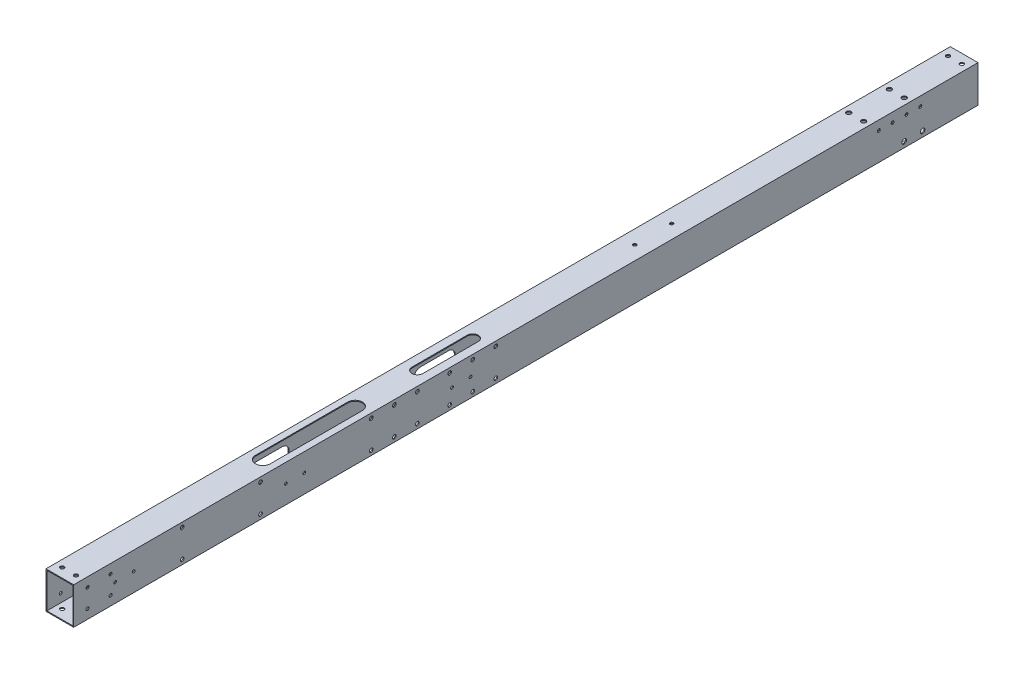
from build123d import *

# Parameters (mm, degrees)
SKETCH_1_W           = 30
SKETCH_1_H           = 40
SKETCH_1_W_2         = 28
SKETCH_1_H_2         = 38
EXTRUDE_1_DEPTH      = 940
SKETCH_5_R           = 2.5
CUT_EXTRUDE_3_DEPTH  = 941.97024395
CUT_EXTRUDE_4_DEPTH  = 1
SKETCH_7_R           = 1.5
CUT_EXTRUDE_5_DEPTH  = 1
SKETCH_17_W          = 30
SKETCH_17_H          = 40
SKETCH_17_W_2        = 28
SKETCH_17_H_2        = 38
EXTRUDE_2_DEPTH      = 20
SKETCH_18_W          = 30
SKETCH_18_H          = 40
SKETCH_18_W_2        = 28
SKETCH_18_H_2        = 38
EXTRUDE_3_DEPTH      = 20
SKETCH_19_R          = 2.1
CUT_EXTRUDE_16_DEPTH = 961.950050731
SKETCH_20_R          = 1.6
CUT_EXTRUDE_17_DEPTH = 961.67684473
SKETCH_21_R          = 2.5
SKETCH_21_R_2        = 1.6
CUT_EXTRUDE_18_DEPTH = 961.67684473
SKETCH_23_R          = 2.5
CUT_EXTRUDE_19_DEPTH = 961.950050731
SKETCH_24_R          = 4.5
CUT_EXTRUDE_20_DEPTH = 10
SKETCH_25_W          = 114.67616049
SKETCH_25_H          = 1154.562704257
CUT_EXTRUDE_21_DEPTH = 968.690549711
SKETCH_26_R          = 2
CUT_EXTRUDE_22_DEPTH = 961.67684473
CUT_EXTRUDE_23_DEPTH = 10
SKETCH_28_R          = 1.5
CUT_EXTRUDE_24_DEPTH = 10
SKETCH_29_R          = 1.5
CUT_EXTRUDE_25_DEPTH = 10
CUT_EXTRUDE_26_DEPTH = 10
SKETCH_31_R          = 1.75
CUT_EXTRUDE_27_DEPTH = 10
SKETCH_34_W          = 70
SKETCH_34_H          = 15
CUT_EXTRUDE_28_DEPTH = 10
EXTRUDE_4_DEPTH      = 1
SKETCH_36_W          = 50.706907747
SKETCH_36_H          = 15.381529857
EXTRUDE_5_DEPTH      = 1
FILLET_1_R           = 3
SKETCH_37_R          = 1.75
CUT_EXTRUDE_29_DEPTH = 81


with BuildPart() as part:
    # 草图1 → 凸台-拉伸1 (new body)
    with BuildSketch(Plane.XY):
        Rectangle(SKETCH_1_W, SKETCH_1_H)
        Rectangle(SKETCH_1_W_2, SKETCH_1_H_2, mode=Mode.SUBTRACT)
    extrude(amount=EXTRUDE_1_DEPTH)

    # 草图5 → 切除-拉伸3 (cut, through all)
    with BuildSketch(Plane.XZ.offset(20)):
        with Locations((-8, 53)):
            Circle(SKETCH_5_R)
        with Locations((8, 53)):
            Circle(SKETCH_5_R)
        with Locations((-8, 97)):
            Circle(SKETCH_5_R)
        with Locations((8, 97)):
            Circle(SKETCH_5_R)
    extrude(amount=-CUT_EXTRUDE_3_DEPTH, mode=Mode.SUBTRACT)

    # 草图6 → 切除-拉伸4 (cut)
    with BuildSketch(Plane(origin=(15, 0, 0), x_dir=(0, 0, -1), z_dir=(1, 0, 0))):
        with BuildLine():
            Line((-345, -7.5), (-375, -7.5))
            ThreePointArc((-375, -7.5), (-382.5, 0), (-375, 7.5))
            Line((-375, 7.5), (-345, 7.5))
            ThreePointArc((-345, 7.5), (-337.5, 0), (-345, -7.5))
        make_face()
        with BuildLine():
            Line((-525, -7.5), (-555, -7.5))
            ThreePointArc((-555, -7.5), (-562.5, 0), (-555, 7.5))
            Line((-555, 7.5), (-525, 7.5))
            ThreePointArc((-525, 7.5), (-517.5, 0), (-525, -7.5))
        make_face()
        with BuildLine():
            Line((-705, -7.5), (-735, -7.5))
            ThreePointArc((-735, -7.5), (-742.5, 0), (-735, 7.5))
            Line((-735, 7.5), (-705, 7.5))
            ThreePointArc((-705, 7.5), (-697.5, 0), (-705, -7.5))
        make_face()
    extrude(amount=-CUT_EXTRUDE_4_DEPTH, mode=Mode.SUBTRACT)

    # 草图7 → 切除-拉伸5 (cut)
    with BuildSketch(Plane.ZY.offset(15)):
        with Locations((350, 0)):
            Circle(SKETCH_7_R)
        with Locations((370, 0)):
            Circle(SKETCH_7_R)
        with Locations((530, 0)):
            Circle(SKETCH_7_R)
        with Locations((550, 0)):
            Circle(SKETCH_7_R)
        with Locations((710, 0)):
            Circle(SKETCH_7_R)
        with Locations((730, 0)):
            Circle(SKETCH_7_R)
    extrude(amount=-CUT_EXTRUDE_5_DEPTH, mode=Mode.SUBTRACT)

    # 草图17 → 凸台-拉伸2 (add)
    with BuildSketch(Plane.XY.offset(940)):
        Rectangle(SKETCH_17_W, SKETCH_17_H)
        Rectangle(SKETCH_17_W_2, SKETCH_17_H_2, mode=Mode.SUBTRACT)
    extrude(amount=EXTRUDE_2_DEPTH)

    # 草图18 → 凸台-拉伸3 (add)
    with BuildSketch(Plane(origin=(0, 0, 0), x_dir=(-1, 0, 0), z_dir=(0, 0, -1))):
        Rectangle(SKETCH_18_W, SKETCH_18_H)
        Rectangle(SKETCH_18_W_2, SKETCH_18_H_2, mode=Mode.SUBTRACT)
    extrude(amount=EXTRUDE_3_DEPTH)

    # 草图19 → 切除-拉伸16 (cut, through all)
    with BuildSketch(Plane(origin=(0, 20, 0), x_dir=(1, 0, 0), z_dir=(0, 1, 0))):
        with Locations((-7.5, -950)):
            Circle(SKETCH_19_R)
        with Locations((7.5, -950)):
            Circle(SKETCH_19_R)
        with Locations((-7.5, 10)):
            Circle(SKETCH_19_R)
        with Locations((7.5, 10)):
            Circle(SKETCH_19_R)
    extrude(amount=-CUT_EXTRUDE_16_DEPTH, mode=Mode.SUBTRACT)

    # 草图20 → 切除-拉伸17 (cut, through all)
    with BuildSketch(Plane(origin=(15, 0, 0), x_dir=(0, 0, -1), z_dir=(1, 0, 0))):
        with Locations((-945, 10)):
            Circle(SKETCH_20_R)
        with Locations((-920, 10)):
            Circle(SKETCH_20_R)
        with Locations((-920, -10)):
            Circle(SKETCH_20_R)
        with Locations((-945, -10)):
            Circle(SKETCH_20_R)
    extrude(amount=-CUT_EXTRUDE_17_DEPTH, mode=Mode.SUBTRACT)

    # 草图21 → 切除-拉伸18 (cut, through all)
    with BuildSketch(Plane(origin=(15, 0, 0), x_dir=(0, 0, -1), z_dir=(1, 0, 0))):
        with Locations((-40, -14)):
            Circle(SKETCH_21_R)
        with Locations((-60, -14)):
            Circle(SKETCH_21_R)
        with Locations((-42.5, 10)):
            Circle(SKETCH_21_R_2)
        with Locations((-57.5, 10)):
            Circle(SKETCH_21_R_2)
        with Locations((-72.5, 10)):
            Circle(SKETCH_21_R_2)
        with Locations((-87.5, 10)):
            Circle(SKETCH_21_R_2)
    extrude(amount=-CUT_EXTRUDE_18_DEPTH, mode=Mode.SUBTRACT)

    # 草图23 → 切除-拉伸19 (cut, through all)
    with BuildSketch(Plane(origin=(0, 20, 0), x_dir=(1, 0, 0), z_dir=(0, 1, 0))):
        with Locations((0, -520)):
            Circle(SKETCH_23_R)
        with Locations((0, -535)):
            Circle(SKETCH_23_R)
        with Locations((0, -550)):
            Circle(SKETCH_23_R)
        with Locations((0, -565)):
            Circle(SKETCH_23_R)
    extrude(amount=-CUT_EXTRUDE_19_DEPTH, mode=Mode.SUBTRACT)

    # 草图24 → 切除-拉伸20 (cut)
    with BuildSketch(Plane(origin=(0, 20, 0), x_dir=(1, 0, 0), z_dir=(0, 1, 0))):
        with Locations((0, -520)):
            Circle(SKETCH_24_R)
        with Locations((0, -535)):
            Circle(SKETCH_24_R)
        with Locations((0, -550)):
            Circle(SKETCH_24_R)
        with Locations((0, -565)):
            Circle(SKETCH_24_R)
    extrude(amount=-CUT_EXTRUDE_20_DEPTH, mode=Mode.SUBTRACT)


with BuildPart() as body_2:
    # 镜向2: mirrored copy
    add(part.part.mirror(Plane(origin=(-50, 0, 0), x_dir=(0, 0, 1), z_dir=(1, 0, 0))))

    # 草图26 → 切除-拉伸22 (cut, through all)
    with BuildSketch(Plane.ZY.offset(115)):
        with Locations((612.5, 15)):
            Circle(SKETCH_26_R)
        with Locations((612.5, -15)):
            Circle(SKETCH_26_R)
        with Locations((527.5, 15)):
            Circle(SKETCH_26_R)
        with Locations((527.5, -15)):
            Circle(SKETCH_26_R)
        with Locations((842.5, 15)):
            Circle(SKETCH_26_R)
        with Locations((842.5, -15)):
            Circle(SKETCH_26_R)
        with Locations((757.5, 15)):
            Circle(SKETCH_26_R)
        with Locations((757.5, -15)):
            Circle(SKETCH_26_R)
        with Locations((637.5, 15)):
            Circle(SKETCH_26_R)
        with Locations((637.5, -15)):
            Circle(SKETCH_26_R)
        with Locations((552.5, -15)):
            Circle(SKETCH_26_R)
        with Locations((552.5, 15)):
            Circle(SKETCH_26_R)
        with Locations((502.5, 15)):
            Circle(SKETCH_26_R)
        with Locations((502.5, -15)):
            Circle(SKETCH_26_R)
        with Locations((587.5, -15)):
            Circle(SKETCH_26_R)
        with Locations((587.5, 15)):
            Circle(SKETCH_26_R)
    extrude(amount=-CUT_EXTRUDE_22_DEPTH, mode=Mode.SUBTRACT)

    # 草图27 → 切除-拉伸23 (cut)
    with BuildSketch(Plane(origin=(0, 20, 0), x_dir=(1, 0, 0), z_dir=(0, 1, 0))):
        with BuildLine():
            Line((-94, -512.5), (-94, -572.5))
            ThreePointArc((-94, -572.5), (-100, -578.5), (-106, -572.5))
            Line((-106, -572.5), (-106, -512.5))
            ThreePointArc((-106, -512.5), (-100, -506.5), (-94, -512.5))
        make_face()
    extrude(amount=-CUT_EXTRUDE_23_DEPTH, mode=Mode.SUBTRACT)

    # 草图28 → 切除-拉伸24 (cut)
    with BuildSketch(Plane(origin=(-85, 0, 0), x_dir=(0, 0, -1), z_dir=(1, 0, 0))):
        with Locations((-730, 0)):
            Circle(SKETCH_28_R)
        with Locations((-710, 0)):
            Circle(SKETCH_28_R)
        with Locations((-915, 0)):
            Circle(SKETCH_28_R)
        with Locations((-895, 0)):
            Circle(SKETCH_28_R)
    extrude(amount=-CUT_EXTRUDE_24_DEPTH, mode=Mode.SUBTRACT)

    # 草图29 → 切除-拉伸25 (cut)
    with BuildSketch(Plane.XZ.offset(20)):
        with Locations((-105, 740)):
            Circle(SKETCH_29_R)
        with Locations((-105, 720)):
            Circle(SKETCH_29_R)
        with Locations((-105, 700)):
            Circle(SKETCH_29_R)
        with Locations((-105, 680)):
            Circle(SKETCH_29_R)
        with Locations((-105, 660)):
            Circle(SKETCH_29_R)
        with Locations((-105, 640)):
            Circle(SKETCH_29_R)
        with Locations((-105, 620)):
            Circle(SKETCH_29_R)
    extrude(amount=-CUT_EXTRUDE_25_DEPTH, mode=Mode.SUBTRACT)

    # 草图30 → 切除-拉伸26 (cut)
    with BuildSketch(Plane(origin=(0, 20, 0), x_dir=(1, 0, 0), z_dir=(0, 1, 0))):
        with BuildLine():
            Line((-92, -640), (-92, -740))
            ThreePointArc((-92, -740), (-100, -748), (-108, -740))
            Line((-108, -740), (-108, -640))
            ThreePointArc((-108, -640), (-100, -632), (-92, -640))
        make_face()
    extrude(amount=-CUT_EXTRUDE_26_DEPTH, mode=Mode.SUBTRACT)

    # 草图31 → 切除-拉伸27 (cut)
    with BuildSketch(Plane.XZ.offset(20)):
        with Locations((-100, 117)):
            Circle(SKETCH_31_R)
        with Locations((-100, 137)):
            Circle(SKETCH_31_R)
    extrude(amount=-CUT_EXTRUDE_27_DEPTH, mode=Mode.SUBTRACT)

    # 草图34 → 切除-拉伸28 (cut)
    with BuildSketch(Plane.ZY.offset(115)):
        with Locations((315, -11.5)):
            Rectangle(SKETCH_34_W, SKETCH_34_H)
    extrude(amount=-CUT_EXTRUDE_28_DEPTH, mode=Mode.SUBTRACT)

    # 草图35 → 凸台-拉伸4 (add)
    with BuildSketch(Plane.ZY.offset(115)):
        Polygon((336.145770334, -4), (350, -4), (350, -9.077366936), (391.920925018, -9.077366936), (391.920925018, 11.093373936), (336.145770334, 11.093373936), align=None)
    extrude(amount=-EXTRUDE_4_DEPTH)

    # 草图36 → 凸台-拉伸5 (add)
    with BuildSketch(Plane(origin=(-85, 0, 0), x_dir=(0, 0, -1), z_dir=(1, 0, 0))):
        with Locations((-354.422343157, -1.974054468)):
            Rectangle(SKETCH_36_W, SKETCH_36_H)
    extrude(amount=-EXTRUDE_5_DEPTH)

    # 圆角1
    fillet_1_edges = [body_2.edges().sort_by_distance(p)[0] for p in [
        (-114.5, -19, 350),
        (-114.5, -4, 350),
        (-114.5, -4, 280),
        (-114.5, -19, 280),
    ]]
    fillet(fillet_1_edges, radius=FILLET_1_R)

    # 草图37 → 切除-拉伸29 (cut)
    with BuildSketch(Plane.XZ.offset(20)):
        with Locations((-100, 297)):
            Circle(SKETCH_37_R)
        with Locations((-100, 337)):
            Circle(SKETCH_37_R)
    extrude(amount=-CUT_EXTRUDE_29_DEPTH, mode=Mode.SUBTRACT)


with BuildPart() as part_1:
    add(part.part)

    # 草图25 → 切除-拉伸21 (cut, through all)
    with BuildSketch(Plane(origin=(0, 20, 0), x_dir=(1, 0, 0), z_dir=(0, 1, 0))):
        with Locations((7.338080245, -506.215166959)):
            Rectangle(SKETCH_25_W, SKETCH_25_H)
    extrude(amount=-CUT_EXTRUDE_21_DEPTH, mode=Mode.SUBTRACT)


solid = body_2.part
